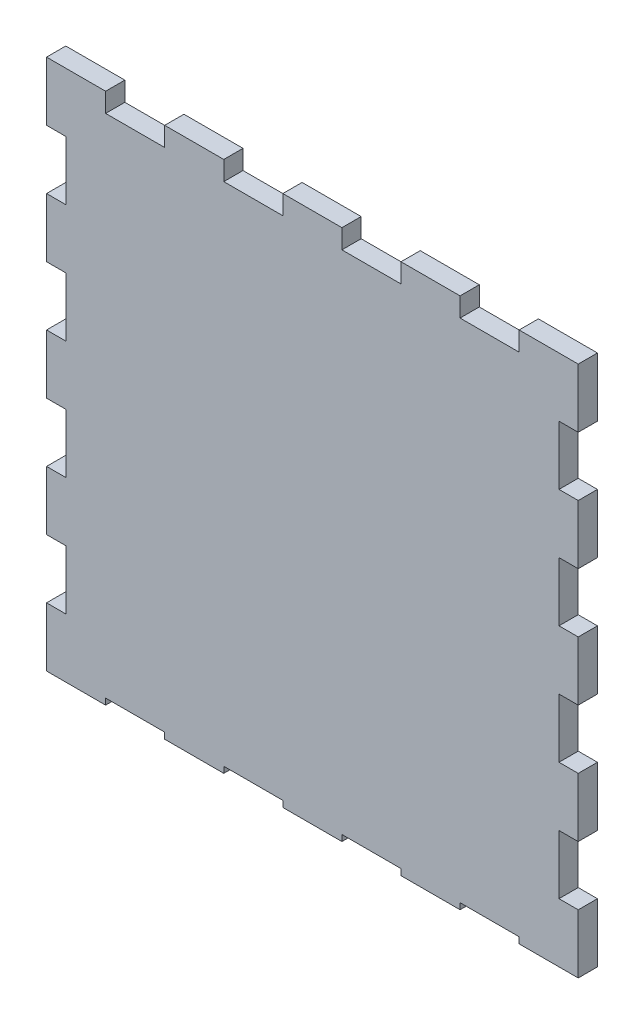
from build123d import *

# Parameters (mm, degrees)
SKETCH2_W           = 137.16
SKETCH2_H           = 137.16
BOSS_EXTRUDE1_DEPTH = 4.9609375
SKETCH3_W           = 4.9609502
SKETCH3_H           = 15.24
SKETCH3_W_2         = 15.24
SKETCH3_H_2         = 4.9609502
SKETCH3_H_3         = 1.5875
CUT_EXTRUDE1_DEPTH  = 98.11356085


with BuildPart() as part:
    # Sketch2 → Boss-Extrude1 (new body)
    with BuildSketch(Plane.XY):
        Rectangle(SKETCH2_W, SKETCH2_H)
    extrude(amount=BOSS_EXTRUDE1_DEPTH)

    # Sketch3 → Cut-Extrude1 (cut, through all)
    with BuildSketch(Plane.XY.offset(4.9609375)):
        with Locations((-66.0995249, 15.24)):
            Rectangle(SKETCH3_W, SKETCH3_H)
        with Locations((-66.0995249, 45.72)):
            Rectangle(SKETCH3_W, SKETCH3_H)
        with Locations((-66.0995249, -15.24)):
            Rectangle(SKETCH3_W, SKETCH3_H)
        with Locations((-66.0995249, -45.72)):
            Rectangle(SKETCH3_W, SKETCH3_H)
        with Locations((66.0995249, 15.24)):
            Rectangle(SKETCH3_W, SKETCH3_H)
        with Locations((66.0995249, 45.72)):
            Rectangle(SKETCH3_W, SKETCH3_H)
        with Locations((66.0995249, -15.24)):
            Rectangle(SKETCH3_W, SKETCH3_H)
        with Locations((66.0995249, -45.72)):
            Rectangle(SKETCH3_W, SKETCH3_H)
        with Locations((-15.24, 66.0995249)):
            Rectangle(SKETCH3_W_2, SKETCH3_H_2)
        with Locations((-45.72, 66.0995249)):
            Rectangle(SKETCH3_W_2, SKETCH3_H_2)
        with Locations((15.24, 66.0995249)):
            Rectangle(SKETCH3_W_2, SKETCH3_H_2)
        with Locations((45.72, 66.0995249)):
            Rectangle(SKETCH3_W_2, SKETCH3_H_2)
        with Locations((-15.24, -67.78625)):
            Rectangle(SKETCH3_W_2, SKETCH3_H_3)
        with Locations((-45.72, -67.78625)):
            Rectangle(SKETCH3_W_2, SKETCH3_H_3)
        with Locations((15.24, -67.78625)):
            Rectangle(SKETCH3_W_2, SKETCH3_H_3)
        with Locations((45.72, -67.78625)):
            Rectangle(SKETCH3_W_2, SKETCH3_H_3)
    extrude(amount=-CUT_EXTRUDE1_DEPTH, mode=Mode.SUBTRACT)


solid = part.part
